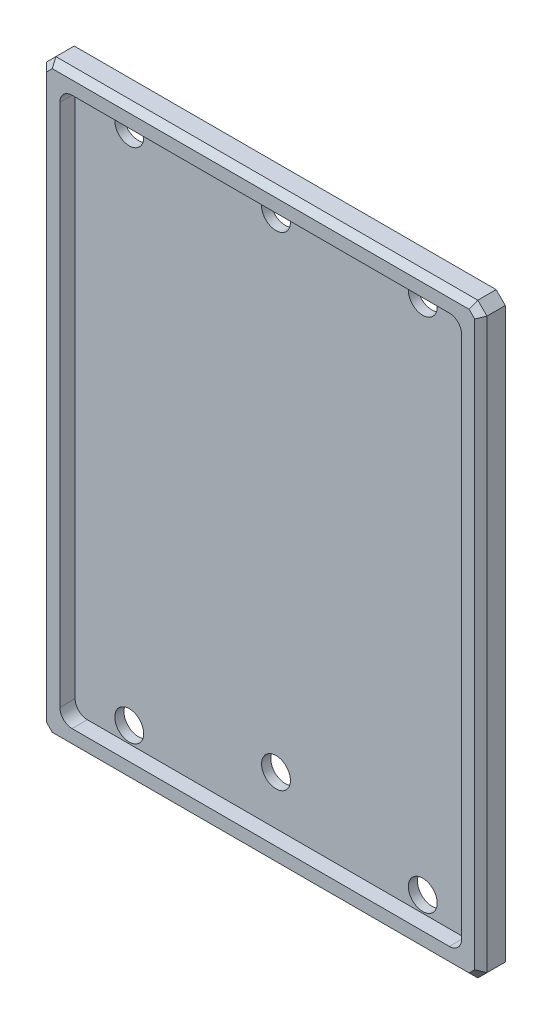
from build123d import *

# Parameters (mm, degrees)
SKETCH1_W                 = 228.6
SKETCH1_H                 = 304.8
BOSS_EXTRUDE1_DEPTH       = 12.7
CUT_EXTRUDE1_DEPTH        = 7.9375
SKETCH4_R                 = 7.5
CUT_EXTRUDE2_DEPTH        = 191.665292873
M4X0_7_TAPPED_HOLE1_D     = 3.3
M4X0_7_TAPPED_HOLE1_DEPTH = 5.4
M4X0_7_TAPPED_HOLE1_TIP   = 0.991420021
CHAMFER1_SIZE             = 4.7625
CHAMFER2_SIZE             = 3.175


with BuildPart() as part:
    # Sketch1 → Boss-Extrude1 (new body)
    with BuildSketch(Plane.XY):
        Rectangle(SKETCH1_W, SKETCH1_H)
    extrude(amount=BOSS_EXTRUDE1_DEPTH)

    # Sketch2 → Cut-Extrude1 (cut)
    with BuildSketch(Plane.XY.offset(12.7)):
        with BuildLine():
            Line((97.95, -142.4), (-97.95, -142.4))
            ThreePointArc((-97.95, -142.4), (-102.440128061, -140.540128061), (-104.3, -136.05))
            Line((-104.3, -136.05), (-104.3, 136.05))
            ThreePointArc((-104.3, 136.05), (-102.440128061, 140.540128061), (-97.95, 142.4))
            Line((-97.95, 142.4), (97.95, 142.4))
            ThreePointArc((97.95, 142.4), (102.440128061, 140.540128061), (104.3, 136.05))
            Line((104.3, 136.05), (104.3, -136.05))
            ThreePointArc((104.3, -136.05), (102.440128061, -140.540128061), (97.95, -142.4))
        make_face()
    extrude(amount=-CUT_EXTRUDE1_DEPTH, mode=Mode.SUBTRACT)

    # Sketch4 → Cut-Extrude2 (cut, through all)
    with BuildSketch(Plane.XY.offset(4.7625)):
        with Locations((-76.2, 134.05)):
            Circle(SKETCH4_R)
        with Locations((76.2, 134.05)):
            Circle(SKETCH4_R)
        with Locations((-76.2, -134.05)):
            Circle(SKETCH4_R)
        with Locations((76.2, -134.05)):
            Circle(SKETCH4_R)
        with Locations((0, 134.05)):
            Circle(SKETCH4_R)
        with Locations((0, -117)):
            Circle(SKETCH4_R)
    extrude(amount=-CUT_EXTRUDE2_DEPTH, mode=Mode.SUBTRACT)

    # M4x0.7 Tapped Hole1
    with Locations(Plane(origin=(0, 0, 0), x_dir=(-1, 0, 0), z_dir=(0, 0, -1))):
        with Locations((-111.125, -102.4), (-111.125, 0), (-111.125, 113.6)):
            Hole(M4X0_7_TAPPED_HOLE1_D / 2, depth=M4X0_7_TAPPED_HOLE1_DEPTH)
            with Locations((0, 0, -(M4X0_7_TAPPED_HOLE1_DEPTH + M4X0_7_TAPPED_HOLE1_TIP / 2))):  # 118° drill point
                Cone(0, M4X0_7_TAPPED_HOLE1_D / 2, M4X0_7_TAPPED_HOLE1_TIP, mode=Mode.SUBTRACT)

    # Chamfer1
    chamfer1_edges = [part.edges().sort_by_distance(p)[0] for p in [
        (-114.3, -152.4, 6.35),
        (114.3, -152.4, 6.35),
        (-114.3, 152.4, 6.35),
        (114.3, 152.4, 6.35),
    ]]
    chamfer(chamfer1_edges, length=CHAMFER1_SIZE)

    # Chamfer2
    chamfer2_edges = [part.edges().sort_by_distance(p)[0] for p in [
        (-111.91875, 150.01875, 12.7),
        (0, 152.4, 12.7),
        (111.91875, 150.01875, 12.7),
        (114.3, 0, 12.7),
        (111.91875, -150.01875, 12.7),
        (0, -152.4, 12.7),
        (-111.91875, -150.01875, 12.7),
        (-114.3, 0, 12.7),
    ]]
    chamfer(chamfer2_edges, length=CHAMFER2_SIZE)


solid = part.part
